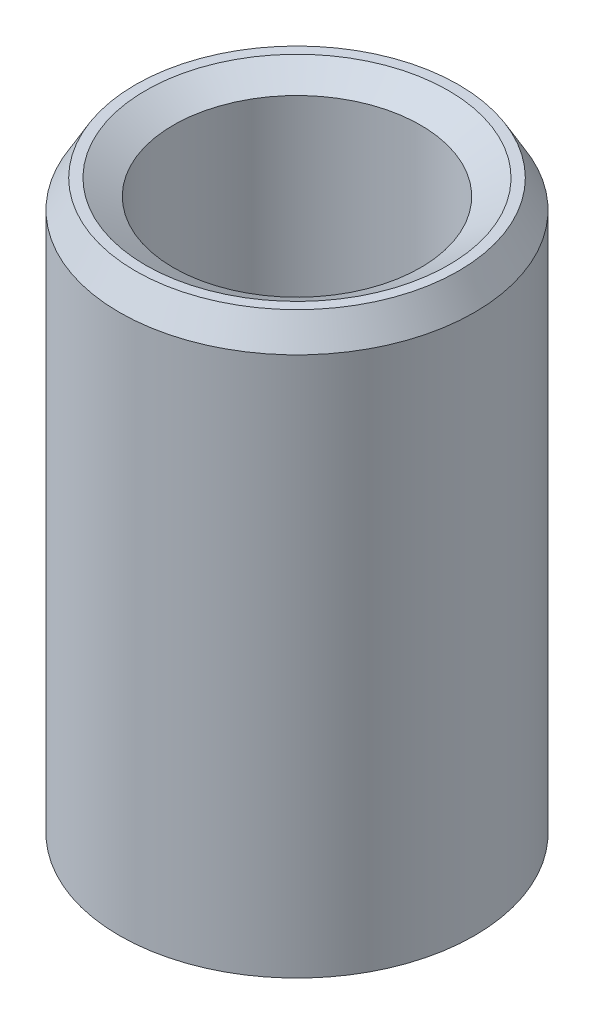
from build123d import *
from OCP.BRepFilletAPI import BRepFilletAPI_MakeChamfer

# Parameters (mm, degrees)
SKETCH1_R           = 25
BOSS_EXTRUDE1_DEPTH = 82.186426969
SKETCH2_R           = 17.401470824
CUT_EXTRUDE1_DEPTH  = 90.468479242
CHAMFER1_SIZE       = 3.915700211
CHAMFER1_SIZE2      = 2.260730571


with BuildPart() as part:
    # Sketch1 → Boss-Extrude1 (new body)
    with BuildSketch(Plane(origin=(0, 0, 0), x_dir=(1, 0, 0), z_dir=(0, 1, 0))):
        Circle(SKETCH1_R)
    extrude(amount=BOSS_EXTRUDE1_DEPTH)

    # Sketch2 → Cut-Extrude1 (cut, through all)
    with BuildSketch(Plane(origin=(0, 0, 0), x_dir=(1, 0, 0), z_dir=(0, 1, 0))):
        Circle(SKETCH2_R)
    extrude(amount=CUT_EXTRUDE1_DEPTH, mode=Mode.SUBTRACT)

    # Chamfer1: one chamfer whose edges measure the first distance from different faces: ONE call of the kernel's chamfer builder (chamfer() names one face for all edges)
    chamfer1_edges_1 = [part.edges().sort_by_distance(p)[0] for p in [
        (-17.401470824, 82.186426969, 0),
    ]]
    chamfer1_side_1 = [part.faces().sort_by_distance(p)[0] for p in [
        (-24.292893219, 82.186426969, 0),
    ]]
    chamfer1_edges_2 = [part.edges().sort_by_distance(p)[0] for p in [
        (-17.401470824, 0, 0),
    ]]
    chamfer1_side_2 = [part.faces().sort_by_distance(p)[0] for p in [
        (-17.401470824, 41.093213484, 0),
    ]]
    chamfer1_edges_3 = [part.edges().sort_by_distance(p)[0] for p in [
        (-25, 0, 0),
    ]]
    chamfer1_side_3 = [part.faces().sort_by_distance(p)[0] for p in [
        (-24.292893219, 0, 0),
    ]]
    chamfer1_edges_4 = [part.edges().sort_by_distance(p)[0] for p in [
        (-25, 82.186426969, 0),
    ]]
    chamfer1_side_4 = [part.faces().sort_by_distance(p)[0] for p in [
        (-25, 41.093213484, 0),
    ]]
    chamfer1 = BRepFilletAPI_MakeChamfer(part.part.solid().wrapped)
    for e in chamfer1_edges_1:
        chamfer1.Add(CHAMFER1_SIZE, CHAMFER1_SIZE2, e.wrapped, chamfer1_side_1[0].wrapped)  # the first distance lies on this face
    for e in chamfer1_edges_2:
        chamfer1.Add(CHAMFER1_SIZE, CHAMFER1_SIZE2, e.wrapped, chamfer1_side_2[0].wrapped)  # the first distance lies on this face
    for e in chamfer1_edges_3:
        chamfer1.Add(CHAMFER1_SIZE, CHAMFER1_SIZE2, e.wrapped, chamfer1_side_3[0].wrapped)  # the first distance lies on this face
    for e in chamfer1_edges_4:
        chamfer1.Add(CHAMFER1_SIZE, CHAMFER1_SIZE2, e.wrapped, chamfer1_side_4[0].wrapped)  # the first distance lies on this face
    add(Compound.cast(chamfer1.Shape()), mode=Mode.REPLACE)


solid = part.part
